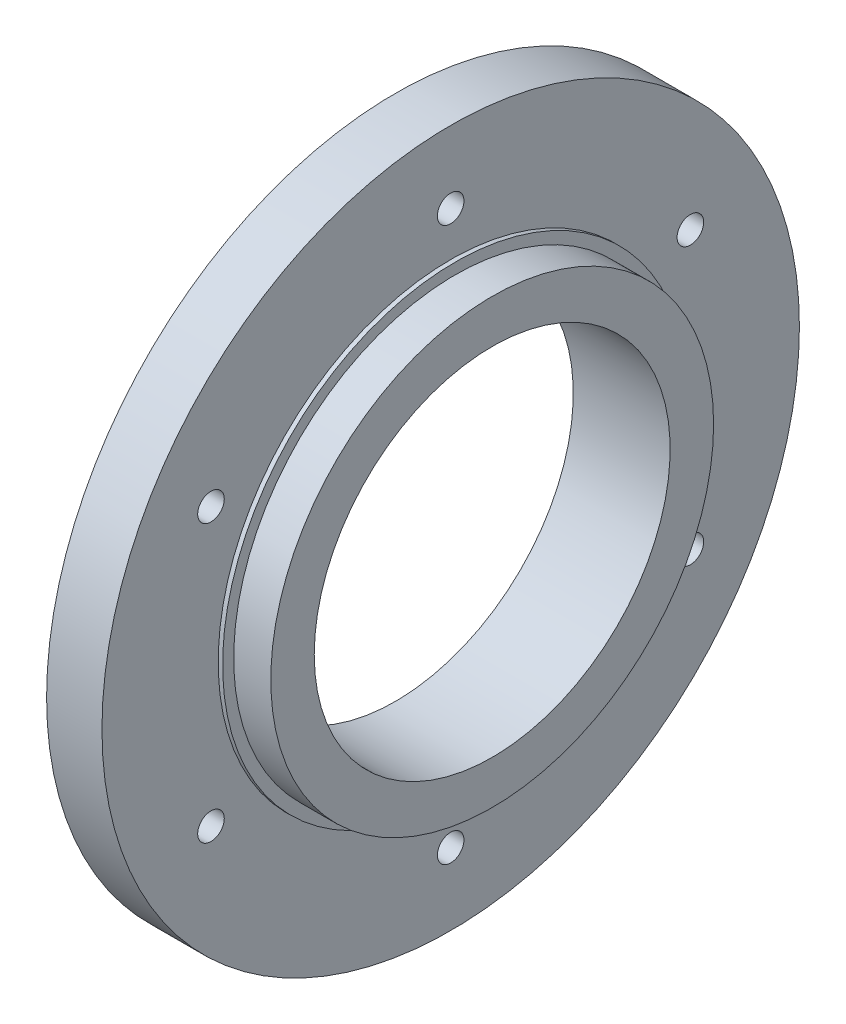
from build123d import *

# Parameters (mm, degrees)
SKIZZE2_R                        = 16.075
SCHNITT_LINEAR_AUSTRAGEN1_DEPTH  = 46.398926199
F_2_4_2_4_DURCHMESSER_BOHRUNG1_D = 2.4
KREISMUSTER2_COUNT               = 6


with BuildPart() as part:
    # Skizze1 → Rotation1 (revolve)
    with BuildSketch(Plane.XY):
        Polygon((0, 0), (0, 31.5), (5, 31.5), (5, 21), (5.4, 21), (5.4, 20), (8.75, 20), (8.75, 0), align=None)
    revolve(axis=Axis((0, 0, 0), (-1, 0, 0)))

    # Skizze2 → Schnitt-Linear austragen1 (cut, through all)
    with BuildSketch(Plane.ZY):
        Circle(SKIZZE2_R)
    extrude(amount=-SCHNITT_LINEAR_AUSTRAGEN1_DEPTH, mode=Mode.SUBTRACT)

    # Ø2.4 (2.4) Durchmesser Bohrung1 (through all)
    with Locations(Plane(origin=(5, 0, 0), x_dir=(0, 0, -1), z_dir=(1, 0, 0))):
        with Locations((0, 25)):
            f_2_4_2_4_durchmesser_bohrung1 = Hole(F_2_4_2_4_DURCHMESSER_BOHRUNG1_D / 2)

    # Kreismuster2: Ø2.4 (2.4) Durchmesser Bohrung1 ×6 about axis
    kreismuster2_axis = Axis((8.75, 0, 0), (-1, 0, 0))
    for i in range(1, KREISMUSTER2_COUNT):
        add(f_2_4_2_4_durchmesser_bohrung1.rotate(kreismuster2_axis, i * 360 / KREISMUSTER2_COUNT), mode=Mode.SUBTRACT)


solid = part.part
